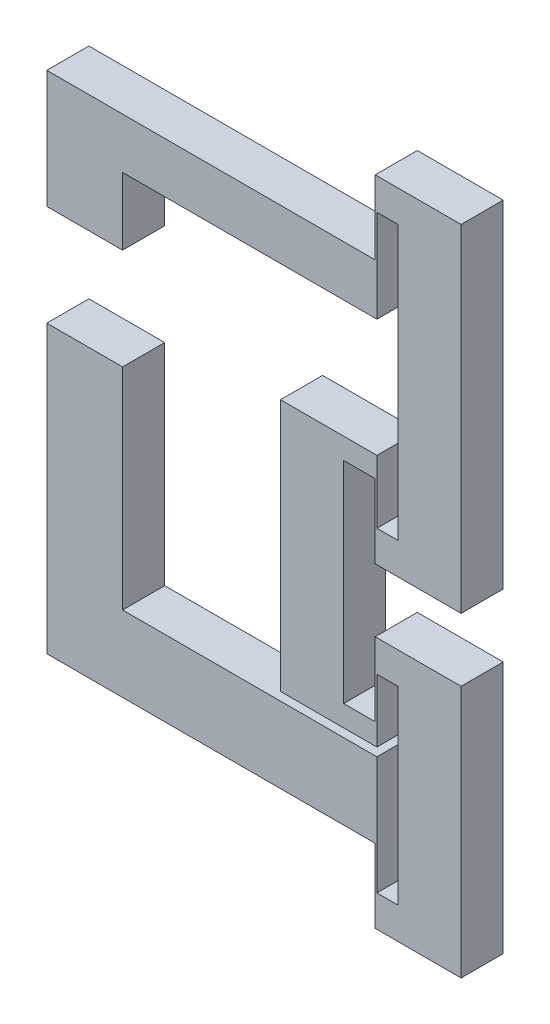
from build123d import *

# Parameters (mm, degrees)
BOSS_EXTRUDE1_DEPTH = 5


with BuildPart() as part:
    # Sketch1 → Boss-Extrude1 (new body)
    with BuildSketch(Plane.XY):
        Polygon((0, 0), (0, 34), (9, 34), (9, 9), (39.2, 9), (39.2, -3.168829952), (39.2, -5), (41.7, -5), (41.7, 17.5), (39.2, 17.5), (39.2, 12.5), (39.2, 10), (27.75, 10), (27.75, 40), (39.2, 40), (39.2, 37.5), (39.2, 32.5), (41.7, 32.5), (41.7, 65), (39.2, 65), (39.2, 60), (39.2, 54), (9, 54), (9, 46), (0, 46), (0, 60), (39, 60), (39, 68.75), (49.2, 68.75), (49.2, 28.75), (39, 28.75), (39, 37.5), (35.25, 37.5), (35.25, 12.5), (39, 12.5), (39, 19.850807945), (39, 21.25), (49.2, 21.25), (49.2, -8.75), (39, -8.75), (39, -5), (39, 0), align=None)
    extrude(amount=BOSS_EXTRUDE1_DEPTH)


solid = part.part
